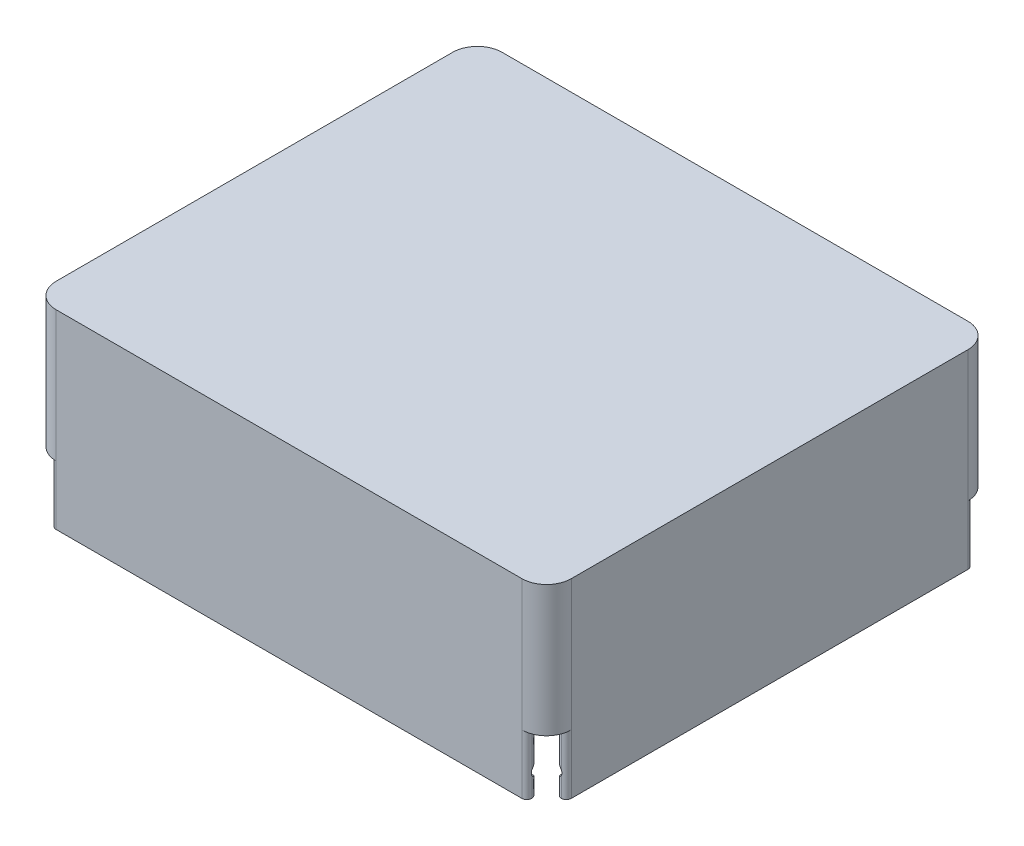
from build123d import *

# Parameters (mm, degrees)
ESQUISSE1_W              = 104.2
ESQUISSE1_H              = 90.2
BOSS_EXTRU_1_DEPTH       = 2
ESQUISSE2_W              = 104.2
ESQUISSE2_H              = 90.2
ESQUISSE2_W_2            = 100.2
ESQUISSE2_H_2            = 86.2
BOSS_EXTRU_2_DEPTH       = 36.5
ENL_V_MAT_EXTRU_1_DEPTH  = 12
SYM_TRIE2_COPY_1_DEPTH   = 12
CONG_3_R                 = 1
CONG_1_R                 = 5
ENL_V_MAT_EXTRU_2_DEPTH  = 78.978650924
ENL_V_MAT_EXTRU_3_DEPTH  = 78.978651027
ESQUISSE15_W             = 100.6
ESQUISSE15_H             = 86.6
ENL_V_MAT_EXTRU_10_DEPTH = 4.5
ENL_V_MAT_EXTRU_11_REACH = 121.264
ESQUISSE17_W             = 14
ESQUISSE17_H             = 9
CONG_4_R                 = 1


with BuildPart() as part:
    # Esquisse1 → Boss.-Extru.1 (new body)
    with BuildSketch(Plane(origin=(0, 0, 0), x_dir=(1, 0, 0), z_dir=(0, 1, 0))):
        Rectangle(ESQUISSE1_W, ESQUISSE1_H)
    extrude(amount=BOSS_EXTRU_1_DEPTH)

    # Esquisse2 → Boss.-Extru.2 (add)
    with BuildSketch(Plane.XZ):
        Rectangle(ESQUISSE2_W, ESQUISSE2_H)
        Rectangle(ESQUISSE2_W_2, ESQUISSE2_H_2, mode=Mode.SUBTRACT)
    extrude(amount=BOSS_EXTRU_2_DEPTH)

    # Esquisse3 → Enlèv. mat.-Extru.1 (cut)
    with BuildSketch(Plane.XZ.offset(36.5)):
        Polygon((-50.1, 41.1), (-50.1, 43.1), (-48.1, 43.1), (-48.1, 45.1), (-52.1, 45.1), (-52.1, 41.1), align=None)
    enl_v_mat_extru_1 = extrude(amount=-ENL_V_MAT_EXTRU_1_DEPTH, mode=Mode.SUBTRACT)

    # Symétrie1: Enlèv. mat.-Extru.1 across plane
    add(enl_v_mat_extru_1.mirror(Plane.XY), mode=Mode.SUBTRACT)

    # Symétrie2: Enlèv. mat.-Extru.1 across plane
    add(enl_v_mat_extru_1.mirror(Plane(origin=(0, 0, 0), x_dir=(0, 0, 1), z_dir=(1, 0, 0))), mode=Mode.SUBTRACT)

    # Symétrie2 copy 1 sketch → Symétrie2 copy 1 (cut)
    with BuildSketch(Plane(origin=(0, -36.5, 0), x_dir=(-1, 0, 0), z_dir=(0, -1, 0))):
        Polygon((-50.1, 41.1), (-50.1, 43.1), (-48.1, 43.1), (-48.1, 45.1), (-52.1, 45.1), (-52.1, 41.1), align=None)
    extrude(amount=-SYM_TRIE2_COPY_1_DEPTH, mode=Mode.SUBTRACT)

    # Congé3
    cong_3_edges = [part.edges().sort_by_distance(p)[0] for p in [
        (-48.1, -30.5, 45.1),
        (-48.1, -30.5, 43.1),
        (-50.1, -30.5, 41.1),
        (-52.1, -30.5, 41.1),
        (48.1, -30.5, 45.1),
        (48.1, -30.5, 43.1),
        (52.1, -30.5, 41.1),
        (50.1, -30.5, 41.1),
        (52.1, -30.5, -41.1),
        (50.1, -30.5, -41.1),
        (48.1, -30.5, -43.1),
        (48.1, -30.5, -45.1),
        (-48.1, -30.5, -45.1),
        (-48.1, -30.5, -43.1),
        (-50.1, -30.5, -41.1),
        (-52.1, -30.5, -41.1),
    ]]
    fillet(cong_3_edges, radius=CONG_3_R - 0.0001)  # a hair under: the kernel refuses the full size

    # Congé1
    cong_1_edges = [part.edges().sort_by_distance(p)[0] for p in [
        (52.1, -11.25, 45.1),
        (52.1, -11.25, -45.1),
        (-52.1, -11.25, -45.1),
        (-52.1, -11.25, 45.1),
    ]]
    fillet(cong_1_edges, radius=CONG_1_R)

    # Esquisse4 → Enlèv. mat.-Extru.2 (cut, symmetric)
    with BuildSketch(Plane(origin=(0, 0, 0), x_dir=(0, 0, -1), z_dir=(1, 0, 0))):
        with BuildLine():
            Line((-43.1, -30.9), (-43.1, -33.1))
            ThreePointArc((-43.1, -33.1), (-44.2, -32), (-43.1, -30.9))
        make_face()
    enl_v_mat_extru_2 = extrude(amount=ENL_V_MAT_EXTRU_2_DEPTH, both=True, mode=Mode.SUBTRACT)

    # Symétrie4: Enlèv. mat.-Extru.2 across plane
    add(enl_v_mat_extru_2.mirror(Plane.XY), mode=Mode.SUBTRACT)

    # Esquisse5 → Enlèv. mat.-Extru.3 (cut, symmetric)
    with BuildSketch(Plane.XY):
        with BuildLine():
            Line((-50.1, -30.9), (-50.1, -33.1))
            ThreePointArc((-50.1, -33.1), (-51.2, -32), (-50.1, -30.9))
        make_face()
    enl_v_mat_extru_3 = extrude(amount=ENL_V_MAT_EXTRU_3_DEPTH, both=True, mode=Mode.SUBTRACT)

    # Symétrie5: Enlèv. mat.-Extru.3 across plane
    add(enl_v_mat_extru_3.mirror(Plane(origin=(0, 0, 0), x_dir=(0, 0, 1), z_dir=(1, 0, 0))), mode=Mode.SUBTRACT)

    # Esquisse15 → Enlèv. mat.-Extru.10 (cut)
    with BuildSketch(Plane.XZ.offset(36.5)):
        Rectangle(ESQUISSE15_W, ESQUISSE15_H)
    extrude(amount=-ENL_V_MAT_EXTRU_10_DEPTH, mode=Mode.SUBTRACT)

    # Enlèv. mat.-Extru.11: up to this face of the body (flat: up to its plane)
    enl_v_mat_extru_11_end = Plane(part.part.faces().sort_by_distance((-50.1, -15.270818347, 0))[0])
    # Esquisse17 → Enlèv. mat.-Extru.11 (cut, up to the picked face)
    with BuildSketch(Plane.ZY.offset(52.1), mode=Mode.PRIVATE) as enl_v_mat_extru_11_sk1:
        with Locations((-2.74, -36.5)):
            Rectangle(ESQUISSE17_W, ESQUISSE17_H)
    enl_v_mat_extru_11_tool1 = split(extrude(enl_v_mat_extru_11_sk1.sketch, amount=-ENL_V_MAT_EXTRU_11_REACH, mode=Mode.PRIVATE), bisect_by=enl_v_mat_extru_11_end, keep=Keep.BOTH, mode=Mode.PRIVATE)
    add(enl_v_mat_extru_11_tool1.solids().sort_by(Axis((-52.1, -36.5, -2.74), (1, 0, 0)))[0], mode=Mode.SUBTRACT)

    # Congé4
    cong_4_edges = [part.edges().sort_by_distance(p)[0] for p in [
        (-51.65, -32, -9.74),
        (-51.65, -32, 4.26),
    ]]
    fillet(cong_4_edges, radius=CONG_4_R)


solid = part.part
